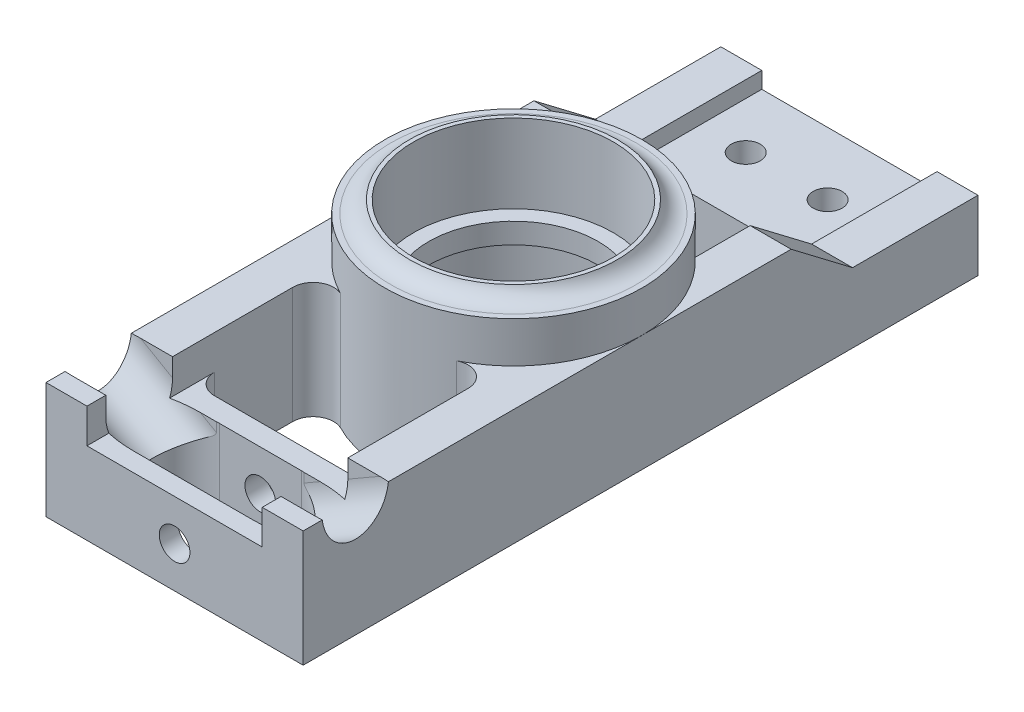
from build123d import *
from build123d.topology import SkipClean

# Parameters (mm, degrees)
HOUSING_FILLET_LIP_R               = 6.35
UBJ_START                          = 36.068
UBJ_MATERIAL_PREP_DEPTH            = 36.068
UBJ_ARM_TK_DEPTH                   = 79.756
SKETCH32_R                         = 4.5
CAMBERBLOCK_HOLES_DEPTH            = 21.59
SKETCH28_W                         = 54.356
SKETCH28_H                         = 38.9128
UBJ_CROSS_MEMBER_TK_DEPTH          = 5.08
UBJ_MASS_CUTTING_REACH             = 119.247
LBJ_START                          = -36.068
LBJ_MATERIAL_PREP_DEPTH            = 36.068
FLAT_LBJ_PREP_DEPTH                = 10.668
LBJ_SLOT_REACH                     = 117.643
LBJ_WEIGHT_AND_BOLT_CLEARING_REACH = 117.643
LBJ_FILLET_R                       = 6.35
LBJ_HOLE_REACH                     = 221.441
SKETCH14_R                         = 4.7625
MOUTH_WIDEN_DEPTH                  = 125.09324931


with BuildPart() as part:
    # Bearing Sketch → Bearing Revolve (revolve)
    with BuildSketch(Plane(origin=(0, 0, 0), x_dir=(0, 0, -1), z_dir=(1, 0, 0)), mode=Mode.PRIVATE) as bearing_revolve_sk:
        Polygon((-39.878, 0), (-39.878, 48.768), (-32.258, 48.768), (-32.258, 52.578), (-30.99943, 52.578), (-30.99943, 28.194), (-26.289, 28.194), (-26.289, 21.844), (-30.99943, 21.844), (-30.99943, 0), align=None)
    revolve(bearing_revolve_sk.sketch.rotate(Axis((0, 0, 0), (0, 1, 0)), 180), axis=Axis((0, 0, 0), (0, 1, 0)))

    # Housing Fillet Lip
    # the kernel refuses this fillet: 6.35 mm, written as the material it adds along each edge
    with BuildSketch(Plane(origin=(0, 48.768, 0), x_dir=(0, 0, -1), z_dir=(1, 0, 0))) as housing_fillet_lip_piece_1:
        with BuildLine():
            CenterArc((38.077871133, 6.35), HOUSING_FILLET_LIP_R, 203.578178478, 66.421821522)
            Line((32.258, 3.81), (32.141602577, 3.7592))
            ThreePointArc((32.141602577, 3.7592), (32.131, 1.905), (32.131, 0))
            Line((32.131, 0), (32.258, -0.127))
            Line((32.258, -0.127), (38.077871133, -0.127))
            Line((38.077871133, -0.127), (38.077871133, 0))
        make_face()
    revolve(axis=Axis((0, 48.768, 0), (0, 1, 0)))

    # PrepArea(WithadjWidth) → UBJ Material Prep (add)
    with BuildSketch(Plane(origin=(0, 0, 0), x_dir=(1, 0, 0), z_dir=(0, 1, 0)).offset(UBJ_START)):
        with BuildLine():
            Line((-39.878, 0), (-39.878, 46.228))
            Line((-39.878, 46.228), (39.878, 46.228))
            Line((39.878, 46.228), (39.878, 0))
            ThreePointArc((39.878, 0), (0, 39.878), (-39.878, 0))
        make_face()
    extrude(amount=-UBJ_MATERIAL_PREP_DEPTH)

    # Sketch27 → UBJ Arm TK (add)
    with BuildSketch(Plane.ZY.offset(39.878)):
        Polygon((-46.228, 36.068), (-65.278, 21.59), (-104.1908, 21.59), (-104.1908, 0), (-91.959544072, 0), (-46.228, 0), align=None)
    extrude(amount=-UBJ_ARM_TK_DEPTH)

    # Sketch32 → CamberBlock Holes (cut)
    with BuildSketch(Plane(origin=(0, 21.59, 0), x_dir=(1, 0, 0), z_dir=(0, 1, 0))):
        with Locations(Location((-12.7, 84.7344, 0), (0, 0, 270))):
            Circle(SKETCH32_R)
        with Locations(Location((12.7, 84.7344, 0), (0, 0, 270))):
            Circle(SKETCH32_R)
    extrude(amount=-CAMBERBLOCK_HOLES_DEPTH, mode=Mode.SUBTRACT)

    # Sketch28 → UBJ Cross Member TK (cut)
    with BuildSketch(Plane(origin=(0, 21.59, 0), x_dir=(1, 0, 0), z_dir=(0, 1, 0))):
        with Locations((0, 84.7344)):
            Rectangle(SKETCH28_W, SKETCH28_H)
    extrude(amount=-UBJ_CROSS_MEMBER_TK_DEPTH, mode=Mode.SUBTRACT)

    # Sketch30 → UBJ Mass Cutting (cut, up to next)
    with BuildSketch(Plane(origin=(0, 36.068, 0), x_dir=(1, 0, 0), z_dir=(0, 1, 0)), mode=Mode.PRIVATE) as ubj_mass_cutting_sk1:
        with BuildLine():
            Line((-27.178, 65.278), (27.178, 65.278))
            Line((27.178, 65.278), (27.178, 29.182378244))
            ThreePointArc((27.178, 29.182378244), (0, 39.878), (-27.178, 29.182378244))
            Line((-27.178, 29.182378244), (-27.178, 65.278))
        make_face()
    ubj_mass_cutting_tool1 = extrude(ubj_mass_cutting_sk1.sketch, amount=-UBJ_MASS_CUTTING_REACH, mode=Mode.PRIVATE) & part.part
    add(ubj_mass_cutting_tool1.solids().sort_by_distance((0, 36.068, -50.735285))[0], mode=Mode.SUBTRACT)

    # Sketch9 → LBJ Material Prep (add)
    with BuildSketch(Plane.XZ.offset(LBJ_START)):
        with BuildLine():
            Line((-39.878, 0), (-39.878, 105.0925))
            Line((-39.878, 105.0925), (39.878, 105.0925))
            Line((39.878, 105.0925), (39.878, 0))
            ThreePointArc((39.878, 0), (0, 39.878), (-39.878, 0))
        make_face()
    extrude(amount=LBJ_MATERIAL_PREP_DEPTH)

    # Sketch10 → Flat LBJ Prep (cut)
    with SkipClean():  # the faces are left unmerged after this step: merging them gives an invalid solid
        with BuildSketch(Plane(origin=(0, 36.068, 0), x_dir=(1, 0, 0), z_dir=(0, 1, 0))):
            with BuildLine():
                Line((-27.178, -29.182378244), (-27.178, -105.0925))
                Line((-27.178, -105.0925), (27.178, -105.0925))
                Line((27.178, -105.0925), (27.178, -29.182378244))
                ThreePointArc((27.178, -29.182378244), (0, -39.878), (-27.178, -29.182378244))
            make_face()
        extrude(amount=-FLAT_LBJ_PREP_DEPTH, mode=Mode.SUBTRACT)

    # Sketch12 → LBJ Slot (cut, up to next)
    with BuildSketch(Plane(origin=(0, 25.4, 0), x_dir=(1, 0, 0), z_dir=(0, 1, 0)), mode=Mode.PRIVATE) as lbj_slot_sk1:
        with BuildLine():
            Line((-12.7, -78.509539434), (12.7, -78.509539434))
            ThreePointArc((12.7, -78.509539434), (23.0505, -88.860039434), (12.7, -99.210539434))
            Line((12.7, -99.210539434), (-12.7, -99.210539434))
            ThreePointArc((-12.7, -99.210539434), (-23.0505, -88.860039434), (-12.7, -78.509539434))
        make_face()
    lbj_slot_tool1 = extrude(lbj_slot_sk1.sketch, amount=-LBJ_SLOT_REACH, mode=Mode.PRIVATE) & part.part
    add(lbj_slot_tool1.solids().sort_by_distance((0, 25.4, 88.860039))[0], mode=Mode.SUBTRACT)

    # Sketch13 → LBJ Weight and Bolt Clearing (cut, up to next)
    with BuildSketch(Plane(origin=(0, 25.4, 0), x_dir=(1, 0, 0), z_dir=(0, 1, 0)), mode=Mode.PRIVATE) as lbj_weight_and_bolt_clearing_sk1:
        with BuildLine():
            Line((-27.178, -29.182378244), (-27.178, -71.867439434))
            Line((-27.178, -71.867439434), (27.178, -71.867439434))
            Line((27.178, -71.867439434), (27.178, -29.182378244))
            ThreePointArc((27.178, -29.182378244), (0, -39.878), (-27.178, -29.182378244))
        make_face()
    lbj_weight_and_bolt_clearing_tool1 = extrude(lbj_weight_and_bolt_clearing_sk1.sketch, amount=-LBJ_WEIGHT_AND_BOLT_CLEARING_REACH, mode=Mode.PRIVATE) & part.part
    add(lbj_weight_and_bolt_clearing_tool1.solids().sort_by_distance((0, 25.4, 54.061372))[0], mode=Mode.SUBTRACT)

    # LBJ Fillet
    # the kernel refuses this fillet: 6.35 mm, written as the material it adds along each edge
    with BuildSketch(Plane(origin=(-27.178, 25.4, 29.182378244), x_dir=(0.8204405839916299, 0, 0.5717317973835926), z_dir=(0, -1, 0))) as lbj_fillet_piece_1:
        with BuildLine():
            CenterArc((12.120741225, 6.286772968), LBJ_FILLET_R, 145.128922247, 116.778941593)
            Line((6.910943516, 9.917269881), (0, 0))
            ThreePointArc((0, 0), (5.613440626, 0.397065762), (11.226881252, 0))
        make_face()
    extrude(amount=25.4)
    with BuildSketch(Plane(origin=(27.178, 25.4, 29.182378244), x_dir=(-0.8204405839916303, 0, 0.5717317973835919), z_dir=(0, -1, 0))) as lbj_fillet_piece_2:
        with BuildLine():
            CenterArc((12.120741225, -6.286772968), LBJ_FILLET_R, 98.09213616, 116.778941593)
            Line((6.910943516, -9.917269881), (0, 0))
            ThreePointArc((0, 0), (5.613440626, -0.397065762), (11.226881252, 0))
        make_face()
    extrude(amount=25.4)
    with BuildSketch(Plane(origin=(27.178, 25.4, 71.867439434), x_dir=(0, 0, -1), z_dir=(0, -1, 0)), Plane(origin=(-27.178, 25.4, 71.867439434), x_dir=(1, 0, 0), z_dir=(0, -1, 0))) as lbj_fillet_piece_3:
        with BuildLine():
            CenterArc((LBJ_FILLET_R, -LBJ_FILLET_R), LBJ_FILLET_R, 90, 90)
            Line((0, -LBJ_FILLET_R), (0, 0))
            Line((0, 0), (LBJ_FILLET_R, 0))
        make_face()
    extrude(amount=25.4)
    with BuildSketch(Plane(origin=(27.178, 36.068, 29.182378244), x_dir=(-0.8204405839916303, 0, 0.5717317973835919), z_dir=(0, -1, 0))) as lbj_fillet_piece_4:
        with BuildLine():
            CenterArc((12.120741225, -6.286772968), LBJ_FILLET_R, 98.09213616, 116.778941593)
            Line((6.910943516, -9.917269881), (0, 0))
            ThreePointArc((0, 0), (5.613440626, -0.397065762), (11.226881252, 0))
        make_face()
    extrude(amount=10.668)
    with BuildSketch(Plane(origin=(-27.178, 36.068, 29.182378244), x_dir=(0.8204405839916299, 0, 0.5717317973835926), z_dir=(0, -1, 0))) as lbj_fillet_piece_5:
        with BuildLine():
            CenterArc((12.120741225, 6.286772968), LBJ_FILLET_R, 145.128922247, 116.778941593)
            Line((6.910943516, 9.917269881), (0, 0))
            ThreePointArc((0, 0), (5.613440626, 0.397065762), (11.226881252, 0))
        make_face()
    extrude(amount=10.668)

    # LBJ Hole: up to this face of the body (flat: up to its plane)
    lbj_hole_end = Plane(part.part.faces().sort_by_distance((0, 12.7, 71.867439434))[0])
    # Sketch14 → LBJ Hole (cut, up to the picked face)
    with BuildSketch(Plane.XY.offset(105.0925), mode=Mode.PRIVATE) as lbj_hole_sk1:
        with Locations((0, 12.7)):
            Circle(SKETCH14_R)
    lbj_hole_tool1 = split(extrude(lbj_hole_sk1.sketch, amount=-LBJ_HOLE_REACH, mode=Mode.PRIVATE), bisect_by=lbj_hole_end, keep=Keep.BOTH, mode=Mode.PRIVATE)
    add(lbj_hole_tool1.solids().sort_by(Axis((0, 12.7, 105.0925), (0, 0, -1)))[0], mode=Mode.SUBTRACT)

    # Sketch33 → Mouth Widen (cut, through all)
    with BuildSketch(Plane(origin=(0, 0, 0), x_dir=(0, 0, 1), z_dir=(-0.8660254037844398, 0.499999999999998, 0))):
        with BuildLine():
            Line((78.5495, 12.7), (78.5495, 22.86))
            ThreePointArc((78.5495, 22.86), (88.9, 33.2105), (99.2505, 22.86))
            Line((99.2505, 22.86), (99.2505, 12.7))
            ThreePointArc((99.2505, 12.7), (88.9, 2.3495), (78.5495, 12.7))
        make_face()
    mouth_widen = extrude(amount=MOUTH_WIDEN_DEPTH, mode=Mode.SUBTRACT)

    # Mouth Mirror: Mouth Widen across plane
    add(mouth_widen.mirror(Plane(origin=(0, 0, 0), x_dir=(0, 0, 1), z_dir=(1, 0, 0))), mode=Mode.SUBTRACT)


solid = part.part
